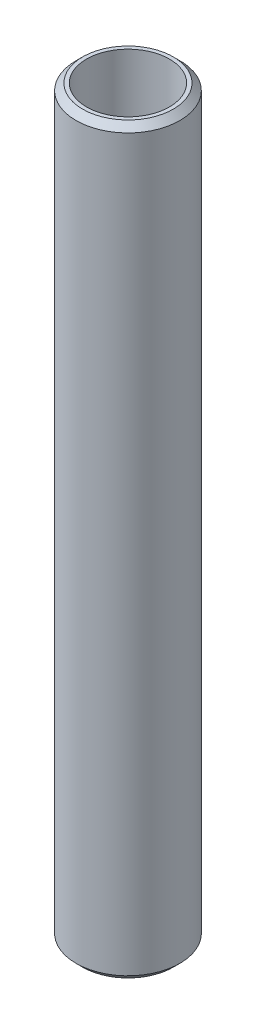
from build123d import *

# Parameters (mm, degrees)
SKETCH1_R           = 37.5
BOSS_EXTRUDE1_DEPTH = 536.91564964
SKETCH2_R           = 29.990263012
CUT_EXTRUDE1_DEPTH  = 540.528418925
CHAMFER1_SIZE       = 4.750883982


with BuildPart() as part:
    # Sketch1 → Boss-Extrude1 (new body)
    with BuildSketch(Plane(origin=(0, 0, 0), x_dir=(1, 0, 0), z_dir=(0, 1, 0))):
        Circle(SKETCH1_R)
    extrude(amount=BOSS_EXTRUDE1_DEPTH)

    # Sketch2 → Cut-Extrude1 (cut, through all)
    with BuildSketch(Plane(origin=(0, 0, 0), x_dir=(1, 0, 0), z_dir=(0, 1, 0))):
        Circle(SKETCH2_R)
    extrude(amount=CUT_EXTRUDE1_DEPTH, mode=Mode.SUBTRACT)

    # Chamfer1
    chamfer1_edges = [part.edges().sort_by_distance(p)[0] for p in [
        (-37.5, 536.91564964, 0),
        (-37.5, 0, 0),
    ]]
    chamfer(chamfer1_edges, length=CHAMFER1_SIZE)


solid = part.part
